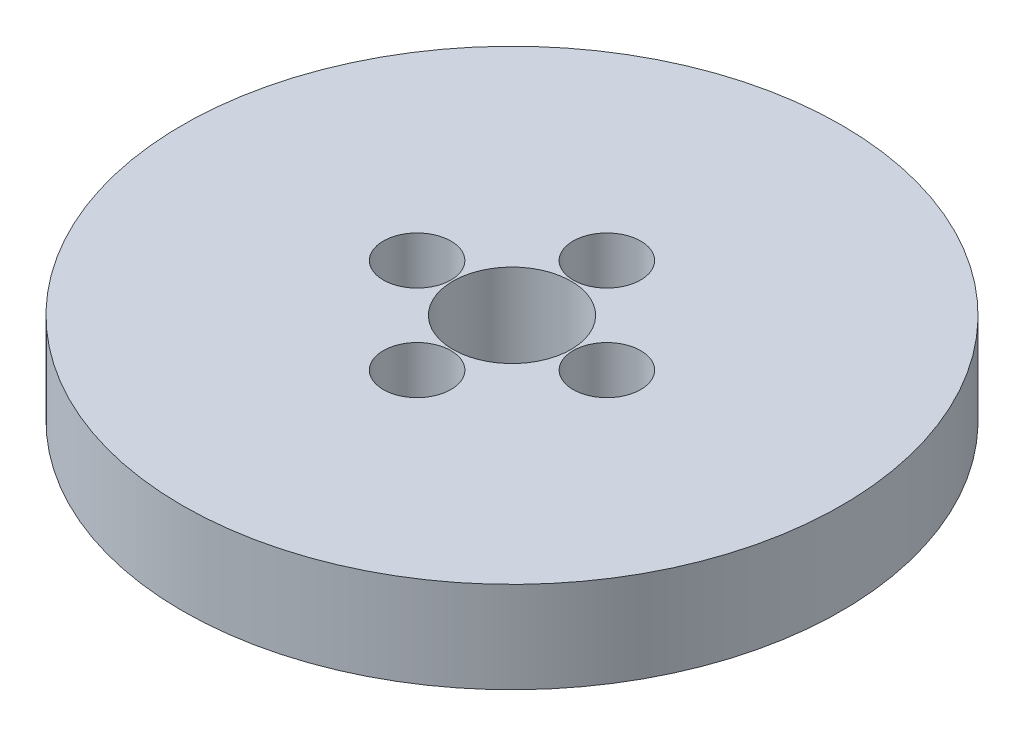
from build123d import *

# Parameters (mm, degrees)
SKETCH1_R           = 97.5
BOSS_EXTRUDE1_DEPTH = 27
SKETCH2_R           = 17.5
CUT_EXTRUDE1_DEPTH  = 141.504448328
SKETCH3_R           = 10
CUT_EXTRUDE2_DEPTH  = 18.637131487
CIRPATTERN1_COUNT   = 4


with BuildPart() as part:
    # Sketch1 → Boss-Extrude1 (new body)
    with BuildSketch(Plane(origin=(0, 0, 0), x_dir=(1, 0, 0), z_dir=(0, 1, 0))):
        Circle(SKETCH1_R)
    extrude(amount=BOSS_EXTRUDE1_DEPTH)

    # Sketch2 → Cut-Extrude1 (cut, through all)
    with BuildSketch(Plane(origin=(0, 0, 0), x_dir=(1, 0, 0), z_dir=(0, 1, 0))):
        Circle(SKETCH2_R)
    extrude(amount=CUT_EXTRUDE1_DEPTH, mode=Mode.SUBTRACT)

    # Sketch3 → Cut-Extrude2 (cut)
    with BuildSketch(Plane(origin=(0, 27, 0), x_dir=(1, 0, 0), z_dir=(0, 1, 0))):
        with Locations((-28.07446152, 0)):
            Circle(SKETCH3_R)
    cut_extrude2 = extrude(amount=-CUT_EXTRUDE2_DEPTH, mode=Mode.SUBTRACT)

    # CirPattern1: Cut-Extrude2 ×4 about axis
    cirpattern1_axis = Axis((0, 0, 0), (0, 1, 0))
    for i in range(1, CIRPATTERN1_COUNT):
        add(cut_extrude2.rotate(cirpattern1_axis, i * 360 / CIRPATTERN1_COUNT), mode=Mode.SUBTRACT)


solid = part.part
